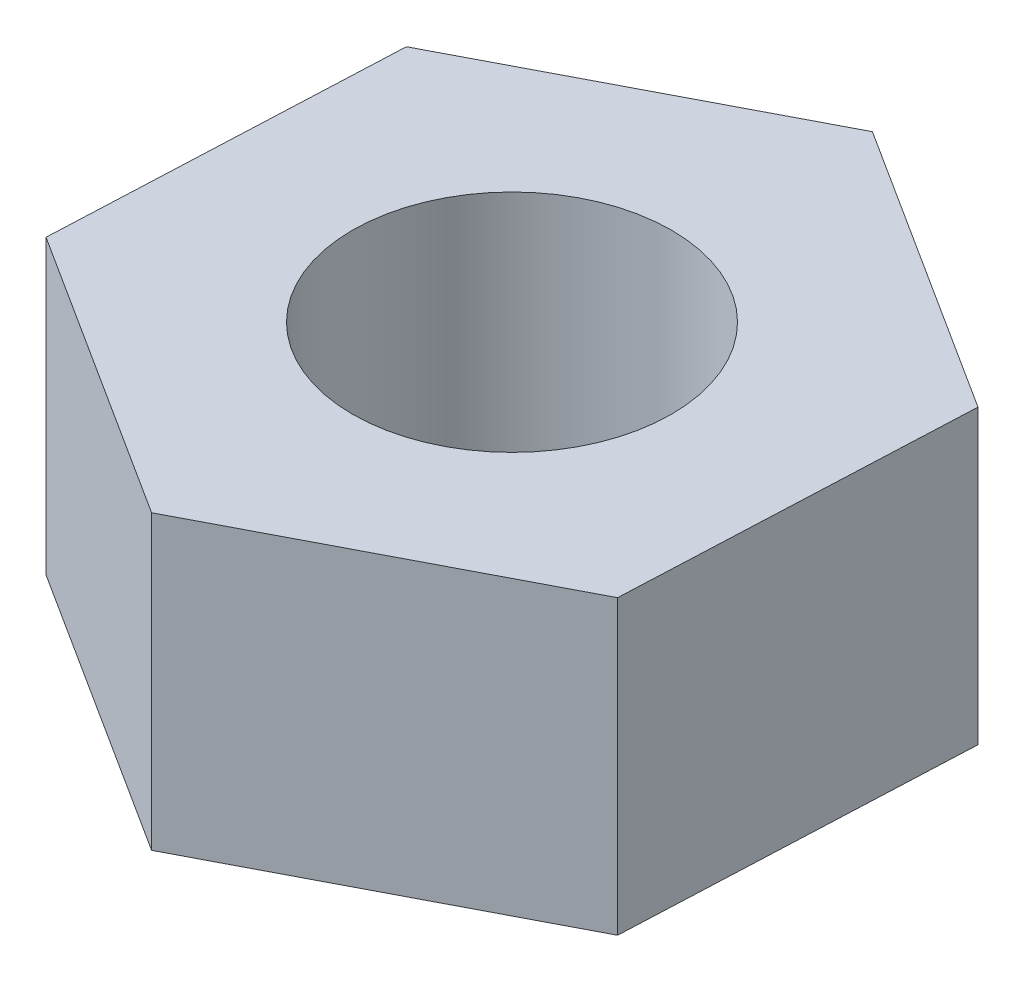
from build123d import *

# Parameters (mm, degrees)
BOSS_EXTRUDE1_DEPTH = 5.5
SKETCH2_R           = 3
CUT_EXTRUDE1_DEPTH  = 5.5


with BuildPart() as part:
    # Sketch1 → Boss-Extrude1 (new body)
    with BuildSketch(Plane(origin=(0, 0, 0), x_dir=(1, 0, 0), z_dir=(0, 1, 0))):
        Polygon((5.480812472, -3.494380438), (5.766628466, 2.999332615), (0.285815994, 6.493713053), (-5.480812472, 3.494380438), (-5.766628466, -2.999332615), (-0.285815994, -6.493713053), align=None)
    extrude(amount=BOSS_EXTRUDE1_DEPTH)

    # Sketch2 → Cut-Extrude1 (cut)
    with BuildSketch(Plane(origin=(0, 5.5, 0), x_dir=(1, 0, 0), z_dir=(0, 1, 0))):
        Circle(SKETCH2_R)
    extrude(amount=-CUT_EXTRUDE1_DEPTH, mode=Mode.SUBTRACT)


solid = part.part
